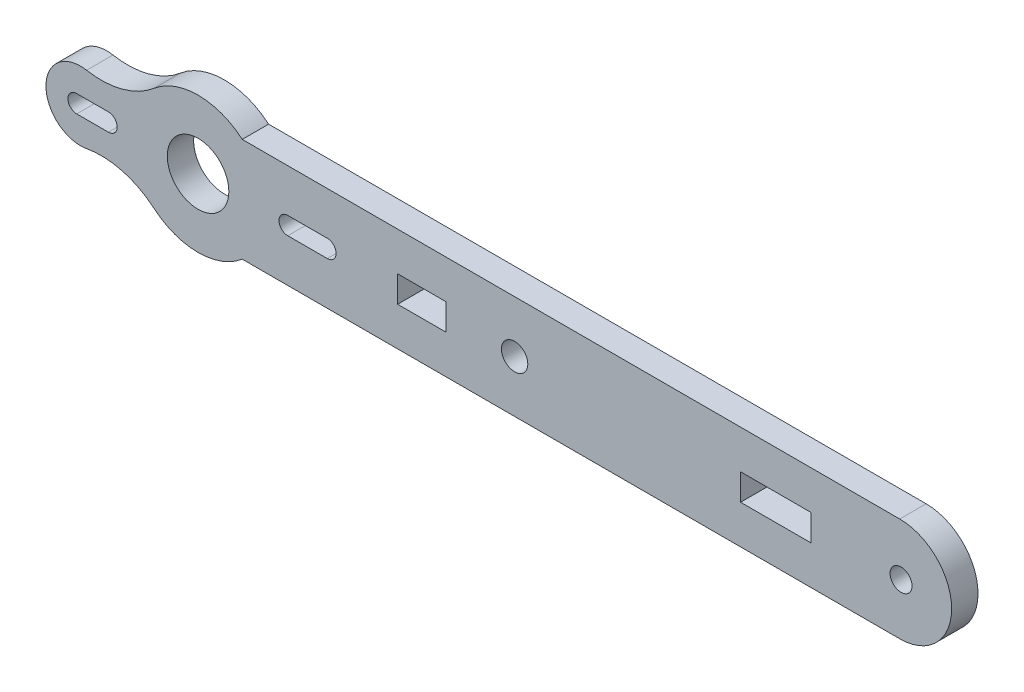
from build123d import *

# Parameters (mm, degrees)
ESQUISSE2_R               = 3.5
ESQUISSE2_R_2             = 1.25
ESQUISSE2_R_3             = 1.5
ESQUISSE2_W               = 8
ESQUISSE2_H               = 3
ESQUISSE2_W_2             = 5.5
T_LE_DE_BASE_PLI_E1_DEPTH = 3


# Sheet-metal steps are written as plain solids
with BuildPart() as part:
    # Esquisse2 → Tôle de base pliée1 (new body)
    with BuildSketch(Plane.XY):
        with BuildLine():
            Line((-80.674813436, 13.65), (-5.9, 13.65))
            ThreePointArc((-5.9, 13.65), (0, 7.75), (-5.9, 1.85))
            Line((-5.9, 1.85), (-80.674813436, 1.85))
            ThreePointArc((-80.674813436, 1.85), (-85.688411127, 8.665e-06), (-90.707519116, 1.834997692))
            ThreePointArc((-90.707519116, 1.834997692), (-94.311259808, 3.720569786), (-98.375041782, 3.887917208))
            ThreePointArc((-98.375041782, 3.887917208), (-102.999999988, 7.750307003), (-98.374437627, 11.611973247))
            ThreePointArc((-98.374437627, 11.611973247), (-94.311297529, 11.778940178), (-90.708236779, 13.664394674))
            ThreePointArc((-90.708236779, 13.664394674), (-85.688881301, 15.499992024), (-80.674813436, 13.65))
        make_face()
        with Locations((-85.7, 7.75)):
            Circle(ESQUISSE2_R, mode=Mode.SUBTRACT)
        with Locations((-5.75, 7.75)):
            Circle(ESQUISSE2_R_2, mode=Mode.SUBTRACT)
        with Locations((-49.7, 7.75)):
            Circle(ESQUISSE2_R_3, mode=Mode.SUBTRACT)
        with Locations((-20, 7.75)):
            Rectangle(ESQUISSE2_W, ESQUISSE2_H, mode=Mode.SUBTRACT)
        with Locations((-60.25, 7.75)):
            Rectangle(ESQUISSE2_W_2, ESQUISSE2_H, mode=Mode.SUBTRACT)
        with BuildLine():
            Line((-75.5, 8.75), (-71, 8.75))
            ThreePointArc((-71, 8.75), (-70, 7.75), (-71, 6.75))
            Line((-71, 6.75), (-75.5, 6.75))
            ThreePointArc((-75.5, 6.75), (-76.5, 7.75), (-75.5, 8.75))
        make_face(mode=Mode.SUBTRACT)
        with BuildLine():
            Line((-99.5, 8.75), (-95.9, 8.75))
            ThreePointArc((-95.9, 8.75), (-94.9, 7.75), (-95.9, 6.75))
            Line((-95.9, 6.75), (-99.5, 6.75))
            ThreePointArc((-99.5, 6.75), (-100.5, 7.75), (-99.5, 8.75))
        make_face(mode=Mode.SUBTRACT)
    extrude(amount=-T_LE_DE_BASE_PLI_E1_DEPTH)


solid = part.part
